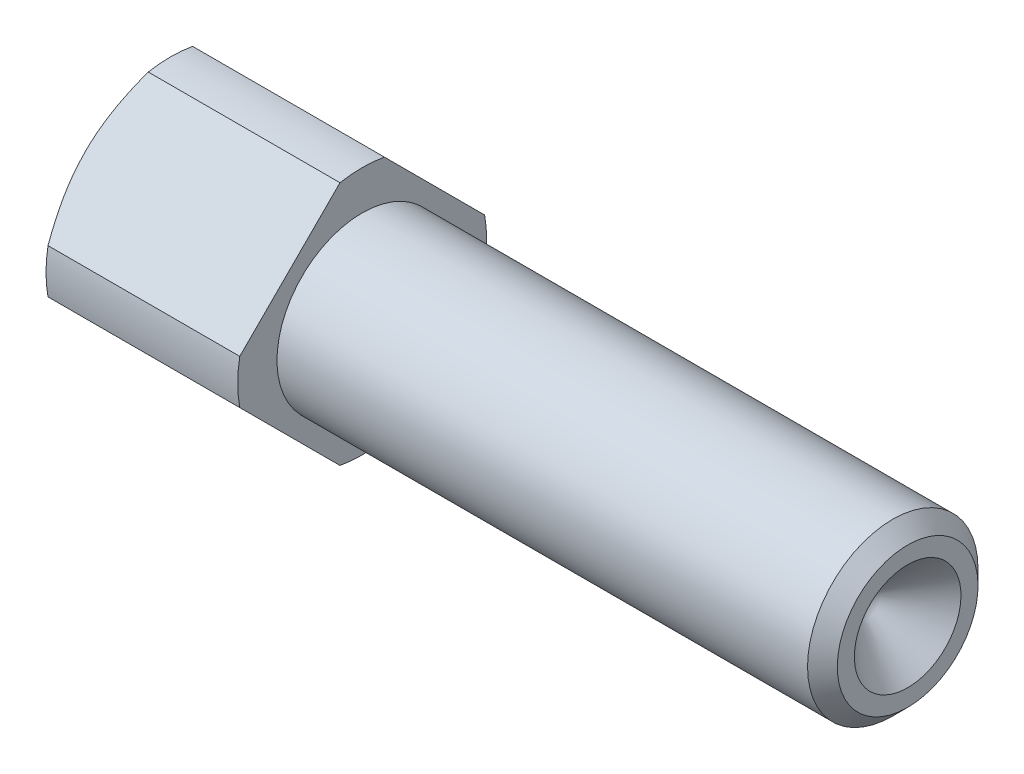
from build123d import *

# Parameters (mm, degrees)
SKETCH1_R          = 3.65
BASEHEAD_DEPTH     = 6
SKETCH2_OUTSIDE_W  = 11.688
SKETCH2_OUTSIDE_H  = 11.688
CUT_EXTRUDE1_DEPTH = 6
CHAMFER1_SIZE      = 0.436657819


with BuildPart() as part:
    # Sketch1 → BaseHead (new body)
    with BuildSketch(Plane(origin=(0, 0, 0), x_dir=(0, 0, -1), z_dir=(1, 0, 0))):
        Circle(SKETCH1_R)
    extrude(amount=BASEHEAD_DEPTH)

    # Sketch2 outside → Cut-Extrude1 (cut)
    with BuildSketch(Plane(origin=(0, -2.241457749, -0.246290957), x_dir=(0, 0, 1), z_dir=(-1, 0, 0))):
        with Locations((0.246, 2.241)):
            Rectangle(SKETCH2_OUTSIDE_W, SKETCH2_OUTSIDE_H)
        Polygon((4.488931645, 2.241457749), (0.246290957, 6.484098436), (-3.99634973, 2.241457749), (0.246290957, -2.001182938), align=None, mode=Mode.SUBTRACT)
    extrude(amount=-CUT_EXTRUDE1_DEPTH, mode=Mode.SUBTRACT)

    # Sketch3 → Cut-Revolve1 (revolve, cut)
    with BuildSketch(Plane(origin=(1.259716749, -5.274716749, 0), x_dir=(0, -1, 0), z_dir=(0, 0, 1))):
        Polygon((-9.289716749, -1.259716749), (-8.274716749, -1.259716749), (-9.289716749, -0.673706226), align=None)
    revolve(axis=Axis((1.545283251, 0, 0), (-1, 0, 0)), mode=Mode.SUBTRACT)

    # Sketch4 → BaseBody (revolve)
    with BuildSketch(Plane(origin=(-10.34721472, 12.84721472, 0), x_dir=(0, -1, 0), z_dir=(0, 0, 1))):
        Polygon((12.84721472, 16.34721472), (15.34721472, 16.34721472), (15.34721472, 32.34721472), (14.410556902, 32.34721472), (12.84721472, 30.783872539), align=None)
    revolve(axis=Axis((14.086803097, 0, 0), (-1, 0, 0)))

    # Chamfer1
    chamfer1_edges = [part.edges().sort_by_distance(p)[0] for p in [
        (22, 2.5, 0),
    ]]
    chamfer(chamfer1_edges, length=CHAMFER1_SIZE)


solid = part.part
